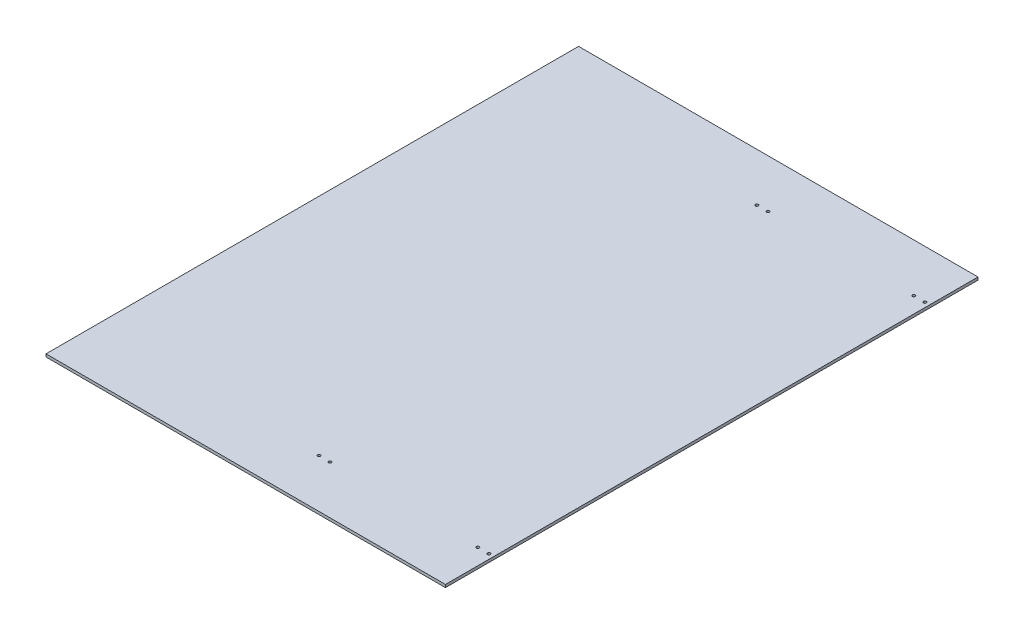
from build123d import *

# Parameters (mm, degrees)
SKETCH1_W           = 914.4
SKETCH1_H           = 1219.2
BOSS_EXTRUDE1_DEPTH = 6.35
SKETCH2_R           = 3.2639
CUT_EXTRUDE1_DEPTH  = 763.026457874


with BuildPart() as part:
    # Sketch1 → Boss-Extrude1 (new body)
    with BuildSketch(Plane(origin=(0, 0, 0), x_dir=(1, 0, 0), z_dir=(0, 1, 0))):
        Rectangle(SKETCH1_W, SKETCH1_H)
    extrude(amount=BOSS_EXTRUDE1_DEPTH)

    # Sketch2 → Cut-Extrude1 (cut, through all)
    with BuildSketch(Plane.XZ):
        with Locations((56.9595, 498.8814)):
            Circle(SKETCH2_R)
        with Locations((82.3595, 498.8814)):
            Circle(SKETCH2_R)
        with Locations((446.0875, 498.8814)):
            Circle(SKETCH2_R)
        with Locations((420.6875, 498.8814)):
            Circle(SKETCH2_R)
        with Locations((61.722, -498.8814)):
            Circle(SKETCH2_R)
        with Locations((87.122, -498.8814)):
            Circle(SKETCH2_R)
        with Locations((420.878, -498.8814)):
            Circle(SKETCH2_R)
        with Locations((446.278, -498.8814)):
            Circle(SKETCH2_R)
    extrude(amount=-CUT_EXTRUDE1_DEPTH, mode=Mode.SUBTRACT)


solid = part.part
